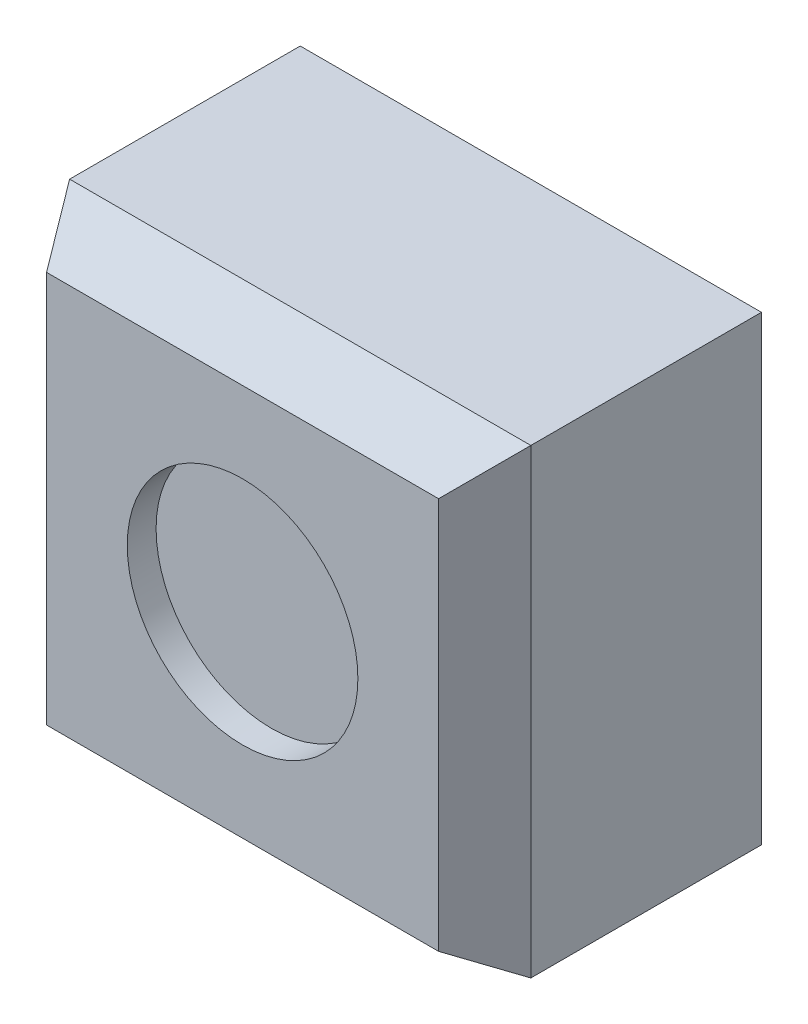
from build123d import *
from OCP.BRepFilletAPI import BRepFilletAPI_MakeChamfer

# Parameters (mm, degrees)
SKETCH1_W           = 16
SKETCH1_H           = 16
BOSS_EXTRUDE1_DEPTH = 10
SKETCH2_R           = 4
CUT_EXTRUDE1_DEPTH  = 1
FILLET4_SIZE        = 2
FILLET4_SIZE2       = 1.2


with BuildPart() as part:
    # Sketch1 → Boss-Extrude1 (new body)
    with BuildSketch(Plane.XY):
        with Locations((8, 8)):
            Rectangle(SKETCH1_W, SKETCH1_H)
    extrude(amount=BOSS_EXTRUDE1_DEPTH)

    # Sketch2 → Cut-Extrude1 (cut)
    with BuildSketch(Plane.XY.offset(10)):
        with Locations((8, 8)):
            Circle(SKETCH2_R)
    extrude(amount=-CUT_EXTRUDE1_DEPTH, mode=Mode.SUBTRACT)

    # Fillet4: one chamfer whose edges measure the first distance from different faces: ONE call of the kernel's chamfer builder (chamfer() names one face for all edges)
    fillet4_edges_1 = [part.edges().sort_by_distance(p)[0] for p in [
        (8, 0, 10),
    ]]
    fillet4_side_1 = [part.faces().sort_by_distance(p)[0] for p in [
        (8, 0, 5),
    ]]
    fillet4_edges_2 = [part.edges().sort_by_distance(p)[0] for p in [
        (16, 8, 10),
    ]]
    fillet4_side_2 = [part.faces().sort_by_distance(p)[0] for p in [
        (16, 8, 5),
    ]]
    fillet4_edges_3 = [part.edges().sort_by_distance(p)[0] for p in [
        (8, 16, 10),
    ]]
    fillet4_side_3 = [part.faces().sort_by_distance(p)[0] for p in [
        (8, 16, 5),
    ]]
    fillet4_edges_4 = [part.edges().sort_by_distance(p)[0] for p in [
        (0, 8, 10),
    ]]
    fillet4_side_4 = [part.faces().sort_by_distance(p)[0] for p in [
        (0, 8, 5),
    ]]
    fillet4 = BRepFilletAPI_MakeChamfer(part.part.solid().wrapped)
    for e in fillet4_edges_1:
        fillet4.Add(FILLET4_SIZE, FILLET4_SIZE2, e.wrapped, fillet4_side_1[0].wrapped)  # the first distance lies on this face
    for e in fillet4_edges_2:
        fillet4.Add(FILLET4_SIZE, FILLET4_SIZE2, e.wrapped, fillet4_side_2[0].wrapped)  # the first distance lies on this face
    for e in fillet4_edges_3:
        fillet4.Add(FILLET4_SIZE, FILLET4_SIZE2, e.wrapped, fillet4_side_3[0].wrapped)  # the first distance lies on this face
    for e in fillet4_edges_4:
        fillet4.Add(FILLET4_SIZE, FILLET4_SIZE2, e.wrapped, fillet4_side_4[0].wrapped)  # the first distance lies on this face
    add(Compound.cast(fillet4.Shape()), mode=Mode.REPLACE)


solid = part.part
